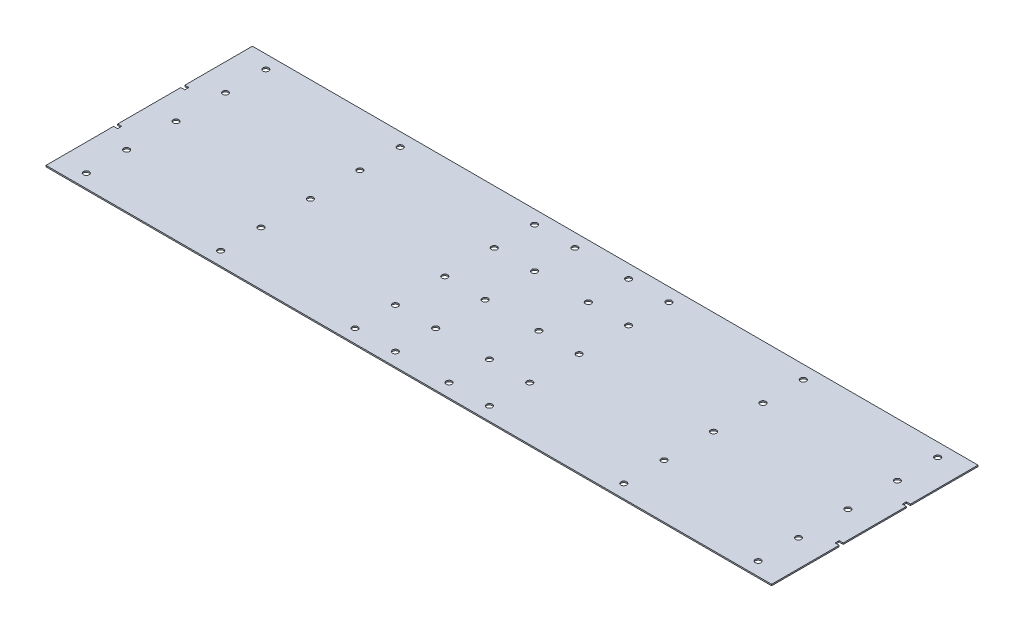
from build123d import *

# Parameters (mm, degrees)
SKETCH1_R           = 2.15
BOSS_EXTRUDE1_DEPTH = 1


with BuildPart() as part:
    # Sketch1 → Boss-Extrude1 (new body)
    with BuildSketch(Plane(origin=(0, 0, 0), x_dir=(1, 0, 0), z_dir=(0, 1, 0))):
        Polygon((-17, -26.5), (-20, -26.5), (-20, -76.8), (520, -76.8), (520, -26.5), (517, -26.5), (517, -23.5), (520, -23.5), (520, 23.5), (517, 23.5), (517, 26.5), (520, 26.5), (520, 76.8), (-20, 76.8), (-20, 26.5), (-17, 26.5), (-17, 23.5), (-20, 23.5), (-20, -23.5), (-17, -23.5), align=None)
        with Locations((0, -66.8)):
            Circle(SKETCH1_R, mode=Mode.SUBTRACT)
        with Locations((100, -66.8)):
            Circle(SKETCH1_R, mode=Mode.SUBTRACT)
        with Locations((200, -66.8)):
            Circle(SKETCH1_R, mode=Mode.SUBTRACT)
        with Locations((230, -66.8)):
            Circle(SKETCH1_R, mode=Mode.SUBTRACT)
        with Locations((0, -36.8)):
            Circle(SKETCH1_R, mode=Mode.SUBTRACT)
        with Locations((100, -36.8)):
            Circle(SKETCH1_R, mode=Mode.SUBTRACT)
        with Locations((200, -36.8)):
            Circle(SKETCH1_R, mode=Mode.SUBTRACT)
        with Locations((230, -36.8)):
            Circle(SKETCH1_R, mode=Mode.SUBTRACT)
        with Locations((270, -66.8)):
            Circle(SKETCH1_R, mode=Mode.SUBTRACT)
        with Locations((300, -66.8)):
            Circle(SKETCH1_R, mode=Mode.SUBTRACT)
        with Locations((400, -66.8)):
            Circle(SKETCH1_R, mode=Mode.SUBTRACT)
        with Locations((500, -66.8)):
            Circle(SKETCH1_R, mode=Mode.SUBTRACT)
        with Locations((270, -36.8)):
            Circle(SKETCH1_R, mode=Mode.SUBTRACT)
        with Locations((300, -36.8)):
            Circle(SKETCH1_R, mode=Mode.SUBTRACT)
        with Locations((400, -36.8)):
            Circle(SKETCH1_R, mode=Mode.SUBTRACT)
        with Locations((500, -36.8)):
            Circle(SKETCH1_R, mode=Mode.SUBTRACT)
        Circle(SKETCH1_R, mode=Mode.SUBTRACT)
        with Locations((100, 0)):
            Circle(SKETCH1_R, mode=Mode.SUBTRACT)
        with Locations((0, 36.8)):
            Circle(SKETCH1_R, mode=Mode.SUBTRACT)
        with Locations((100, 36.8)):
            Circle(SKETCH1_R, mode=Mode.SUBTRACT)
        with Locations((200, 0)):
            Circle(SKETCH1_R, mode=Mode.SUBTRACT)
        with Locations((230, 0)):
            Circle(SKETCH1_R, mode=Mode.SUBTRACT)
        with Locations((200, 36.8)):
            Circle(SKETCH1_R, mode=Mode.SUBTRACT)
        with Locations((230, 36.8)):
            Circle(SKETCH1_R, mode=Mode.SUBTRACT)
        with Locations((0, 66.8)):
            Circle(SKETCH1_R, mode=Mode.SUBTRACT)
        with Locations((100, 66.8)):
            Circle(SKETCH1_R, mode=Mode.SUBTRACT)
        with Locations((200, 66.8)):
            Circle(SKETCH1_R, mode=Mode.SUBTRACT)
        with Locations((230, 66.8)):
            Circle(SKETCH1_R, mode=Mode.SUBTRACT)
        with Locations((270, 0)):
            Circle(SKETCH1_R, mode=Mode.SUBTRACT)
        with Locations((300, 0)):
            Circle(SKETCH1_R, mode=Mode.SUBTRACT)
        with Locations((270, 36.8)):
            Circle(SKETCH1_R, mode=Mode.SUBTRACT)
        with Locations((300, 36.8)):
            Circle(SKETCH1_R, mode=Mode.SUBTRACT)
        with Locations((400, 0)):
            Circle(SKETCH1_R, mode=Mode.SUBTRACT)
        with Locations((500, 0)):
            Circle(SKETCH1_R, mode=Mode.SUBTRACT)
        with Locations((400, 36.8)):
            Circle(SKETCH1_R, mode=Mode.SUBTRACT)
        with Locations((500, 36.8)):
            Circle(SKETCH1_R, mode=Mode.SUBTRACT)
        with Locations((270, 66.8)):
            Circle(SKETCH1_R, mode=Mode.SUBTRACT)
        with Locations((300, 66.8)):
            Circle(SKETCH1_R, mode=Mode.SUBTRACT)
        with Locations((400, 66.8)):
            Circle(SKETCH1_R, mode=Mode.SUBTRACT)
        with Locations((500, 66.8)):
            Circle(SKETCH1_R, mode=Mode.SUBTRACT)
    extrude(amount=BOSS_EXTRUDE1_DEPTH)


solid = part.part
